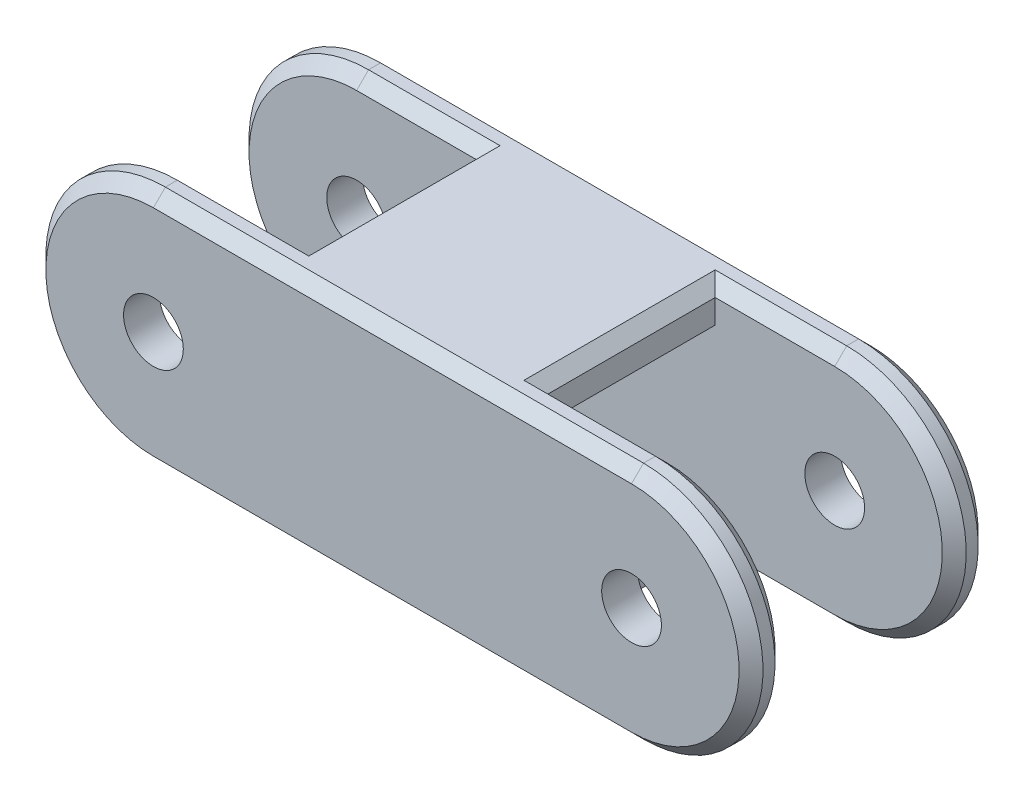
from build123d import *

# Parameters (mm, degrees)
BOSS_EXTRUDE1_DEPTH = 10
CUT_EXTRUDE1_DEPTH  = 7
SKETCH3_R           = 2.5
CUT_EXTRUDE2_DEPTH  = 10
CHAMFER2_SIZE       = 1
CHAMFER3_SIZE       = 1
SHELL1_START        = -7
SHELL1_OUTLINE_W    = 20
SHELL1_OUTLINE_H    = 14
SHELL1_DEPTH        = 14
CHAMFER4_SIZE       = 1


# Read off the part's stored shape, not the designer's step: Shell1
with BuildPart() as part:
    # Sketch1 → Boss-Extrude1 (new, symmetric)
    with BuildSketch(Plane.XY):
        with BuildLine():
            Line((-20, 10), (20, 10))
            ThreePointArc((20, 10), (30, 0), (20, -10))
            Line((20, -10), (-20, -10))
            ThreePointArc((-20, -10), (-30, 0), (-20, 10))
        make_face()
    extrude(amount=BOSS_EXTRUDE1_DEPTH, both=True)

    # Sketch2 → Cut-Extrude1 (cut, symmetric)
    with BuildSketch(Plane.XY):
        with BuildLine():
            Line((-20, 10), (-10, 10))
            Line((-10, 10), (-10, -10))
            Line((-10, -10), (-20, -10))
            ThreePointArc((-20, -10), (-30, 0), (-20, 10))
        make_face()
        with BuildLine():
            Line((10, -10), (20, -10))
            ThreePointArc((20, -10), (30, 0), (20, 10))
            Line((20, 10), (10, 10))
            Line((10, 10), (10, -10))
        make_face()
    extrude(amount=CUT_EXTRUDE1_DEPTH, both=True, mode=Mode.SUBTRACT)

    # Sketch3 → Cut-Extrude2 (cut, symmetric)
    with BuildSketch(Plane.XY):
        with Locations((-20, 0)):
            Circle(SKETCH3_R)
        with Locations(Location((20, 0, 0), (0, 0, 180))):
            Circle(SKETCH3_R)
    extrude(amount=CUT_EXTRUDE2_DEPTH, both=True, mode=Mode.SUBTRACT)

    # Chamfer2
    chamfer2_edges = [part.edges().sort_by_distance(p)[0] for p in [
        (-30, 0, -7),
        (-15, 10, -7),
        (-15, -10, -7),
        (-30, 0, 7),
        (-15, -10, 7),
        (-15, 10, 7),
        (30, 0, -7),
        (15, -10, -7),
        (15, 10, -7),
        (30, 0, 7),
        (15, 10, 7),
        (15, -10, 7),
    ]]
    chamfer(chamfer2_edges, length=CHAMFER2_SIZE)

    # Chamfer3
    chamfer3_edges = [part.edges().sort_by_distance(p)[0] for p in [
        (30, 0, 10),
        (0, 10, 10),
        (-30, 0, 10),
        (0, 10, -10),
        (30, 0, -10),
        (0, -10, -10),
        (-30, 0, -10),
        (0, -10, 10),
    ]]
    chamfer(chamfer3_edges, length=CHAMFER3_SIZE)

    # Shell1 outline → Shell1 (cut)
    with BuildSketch(Plane.XY.offset(SHELL1_START)):
        Rectangle(SHELL1_OUTLINE_W, SHELL1_OUTLINE_H)
    extrude(amount=SHELL1_DEPTH, mode=Mode.SUBTRACT)

    # Chamfer4
    chamfer4_edges = [part.edges().sort_by_distance(p)[0] for p in [
        (10, -10, 0),
        (10, 10, 0),
        (-10, -10, 0),
        (-10, 10, 0),
    ]]
    chamfer(chamfer4_edges, length=CHAMFER4_SIZE)


solid = part.part
